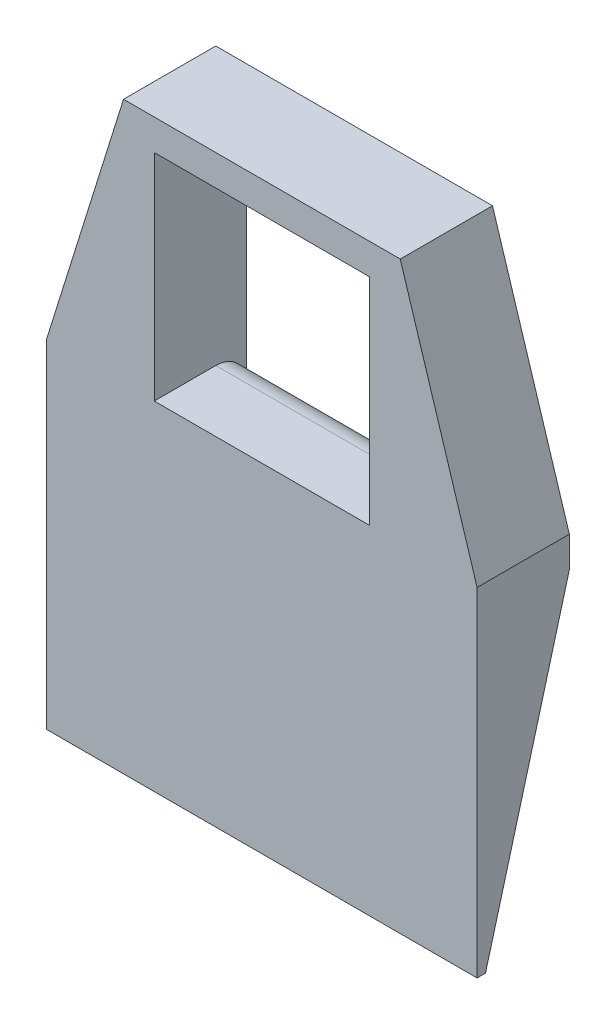
from build123d import *

# Parameters (mm, degrees)
SKETCH1_W           = 28
SKETCH1_H           = 6
BOSS_EXTRUDE1_DEPTH = 2
SKETCH2_W           = 7
SKETCH2_H           = 6
BOSS_EXTRUDE2_DEPTH = 16
SKETCH3_W           = 6
SKETCH3_H           = 2
BOSS_EXTRUDE3_DEPTH = 14
CUT_EXTRUDE1_DEPTH  = 24.579652245
SKETCH5_W           = 28
SKETCH5_H           = 6
BOSS_EXTRUDE4_DEPTH = 22
CUT_EXTRUDE2_DEPTH  = 30
CUT_EXTRUDE3_DEPTH  = 30
FILLET1_R           = 2


with BuildPart() as part:
    # Sketch1 → Boss-Extrude1 (new body)
    with BuildSketch(Plane(origin=(0, 0, 0), x_dir=(1, 0, 0), z_dir=(0, 1, 0))):
        Rectangle(SKETCH1_W, SKETCH1_H)
    extrude(amount=BOSS_EXTRUDE1_DEPTH)

    # Sketch2 → Boss-Extrude2 (add)
    with BuildSketch(Plane(origin=(0, 2, 0), x_dir=(1, 0, 0), z_dir=(0, 1, 0))):
        with Locations((-10.5, 0)):
            Rectangle(SKETCH2_W, SKETCH2_H)
        with Locations((10.5, 0)):
            Rectangle(SKETCH2_W, SKETCH2_H)
    extrude(amount=BOSS_EXTRUDE2_DEPTH)

    # Sketch3 → Boss-Extrude3 (add)
    with BuildSketch(Plane(origin=(-7, 0, 0), x_dir=(0, 0, -1), z_dir=(1, 0, 0))):
        with Locations((0, 17)):
            Rectangle(SKETCH3_W, SKETCH3_H)
    extrude(amount=BOSS_EXTRUDE3_DEPTH)

    # Sketch4 → Cut-Extrude1 (cut, through all)
    with BuildSketch(Plane(origin=(0, 0, -3), x_dir=(-1, 0, 0), z_dir=(0, 0, -1))):
        Polygon((-9, 18), (-14, 18), (-14, 2), align=None)
        Polygon((9, 18), (14, 18), (14, 2), align=None)
    extrude(amount=-CUT_EXTRUDE1_DEPTH, mode=Mode.SUBTRACT)

    # Sketch5 → Boss-Extrude4 (add)
    with BuildSketch(Plane.XZ):
        Rectangle(SKETCH5_W, SKETCH5_H)
    extrude(amount=BOSS_EXTRUDE4_DEPTH)

    # Sketch6 → Cut-Extrude2 (cut)
    with BuildSketch(Plane(origin=(14, 0, 0), x_dir=(0, 0, -1), z_dir=(1, 0, 0))):
        Polygon((3, 0), (-3, -22), (3, -22), align=None)
    extrude(amount=-CUT_EXTRUDE2_DEPTH, mode=Mode.SUBTRACT)

    # Sketch7 → Cut-Extrude3 (cut)
    with BuildSketch(Plane(origin=(14, 0, 0), x_dir=(0, 0, -1), z_dir=(1, 0, 0))):
        Polygon((-3, -22), (-3, -20), (-2.454545455, -20), align=None)
    extrude(amount=-CUT_EXTRUDE3_DEPTH, mode=Mode.SUBTRACT)

    # Fillet1
    fillet1_edges = [part.edges().sort_by_distance(p)[0] for p in [
        (0, 2, -3),
    ]]
    fillet(fillet1_edges, radius=FILLET1_R - 0.0001)  # a hair under: the kernel refuses the full size


solid = part.part
